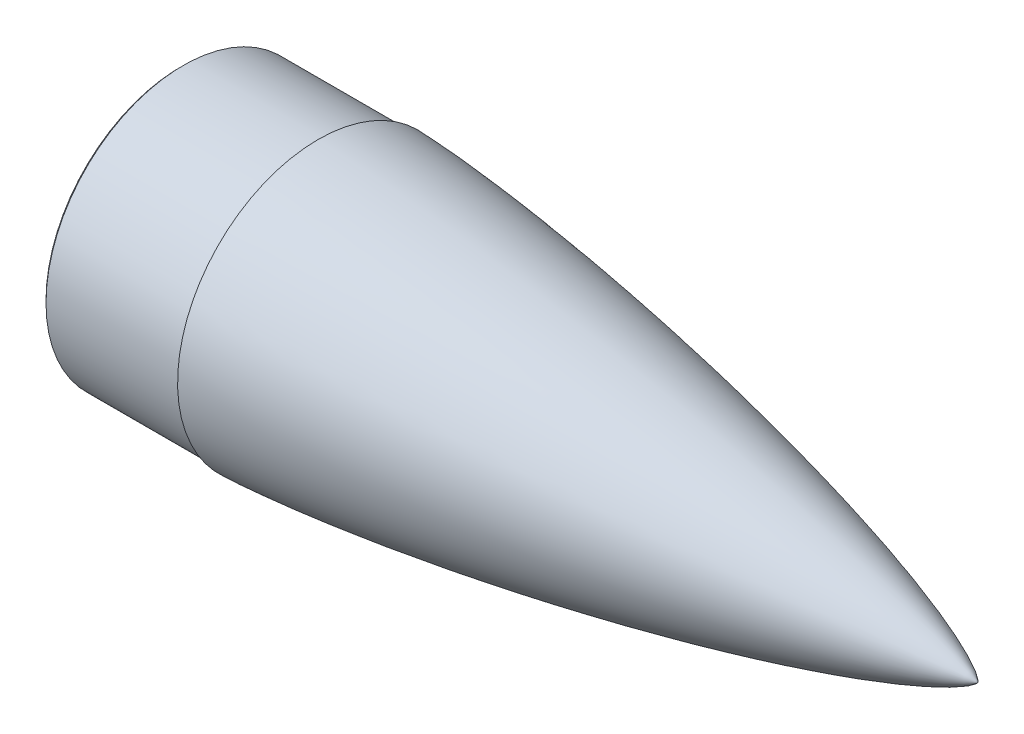
from build123d import *

# Parameters (mm, degrees)
CHAMFER1_SIZE            = 1.5
BOSS_EXTRUDE6_DEPTH      = 7.5
BOSS_EXTRUDE6_DEPTH_BACK = 7.5
SKETCH11_R               = 5


with BuildPart() as part:
    # Sketch10 → Revolve1 (revolve)
    with BuildSketch(Plane.XY):
        with BuildLine():
            Line((11.112493743, 81.99983), (11.112493743, 67.49983))
            Line((11.112493743, 67.49983), (129.304508698, 67.49983))
            add(Edge.make_bspline(
                [(368.967251823, 0), (368.965299543, 0.012338489), (368.959416882, 0.036518378), (368.940636147, 0.082964007), (368.902304552, 0.158736421), (368.845538097, 0.250270687), (368.755690124, 0.376555746), (368.616653262, 0.54835284), (368.392888737, 0.793577299), (368.008659121, 1.164904965), (367.344738263, 1.729853685), (366.176060796, 2.601559154), (364.09282389, 3.960032328), (360.425978756, 6.040734396), (354.402196649, 9.01831007), (344.042994901, 13.507695011), (329.152005398, 19.128483965), (310.425167902, 25.398569259), (288.741266406, 31.933693508), (266.378532845, 38.106125474), (243.901379123, 43.846895186), (221.331994001, 49.212017941), (198.683967629, 54.234500927), (175.966897581, 58.934255644), (156.034567874, 62.771715365), (141.509051931, 65.395628269), (132.679425236, 66.924517444), (129.562757302, 67.455859883), (129.304508698, 67.49983)],
                knots=[0, 0, 0, 0, 0, 0.000134949, 0.000269899, 0.000539798, 0.000919537, 0.001299277, 0.001947431, 0.00293136, 0.004511869, 0.007081312, 0.011380263, 0.018707867, 0.031423867, 0.052705479, 0.084103008, 0.140910136, 0.203703492, 0.266497064, 0.329290816, 0.392084375, 0.454877964, 0.517671564, 0.580465191, 0.643258828, 0.674655593, 0.677492072, 0.677492072, 0.677492072, 0.677492072, 0.677492072], degree=4))
            Line((368.967251823, 0), (408.967251823, 0))
            add(Edge.make_bspline(
                [(408.967251823, 0), (408.964913524, 0.013501739), (408.958040758, 0.039916077), (408.936520441, 0.090485698), (408.892222076, 0.174057132), (408.826281575, 0.275556803), (408.721696416, 0.415833756), (408.561101809, 0.605075245), (408.30561918, 0.87242415), (407.86966713, 1.275299562), (407.120955138, 1.885142115), (405.803773451, 2.82590185), (403.46240692, 4.287152794), (399.325294488, 6.531818454), (392.481146888, 9.758904649), (380.662076725, 14.628008466), (363.637187185, 20.711720382), (342.215241093, 27.476512989), (317.428462321, 34.49762647), (291.879335737, 41.10482439), (266.21046092, 47.228993169), (240.44548836, 52.933436777), (214.598861982, 58.255439009), (188.68089566, 63.217582693), (165.946174917, 67.253280679), (146.421982586, 70.493799722), (130.127893898, 73.044947468), (117.078590637, 74.994157933), (104.015464216, 76.84854079), (92.573263959, 78.384492045), (82.757139441, 79.635603973), (74.571340184, 80.632219902), (68.019260454, 81.400804211), (61.463723364, 82.139375899), (54.90469802, 82.84637726), (48.342159918, 83.519940506), (41.776057559, 84.15778717), (36.02754108, 84.682157239), (31.097921259, 85.105234912), (26.988317923, 85.438669825), (23.699666618, 85.693218594), (20.085807822, 85.958448038), (16.719873821, 86.189018485), (13.602098287, 86.386966779), (10.732704013, 86.554575744), (8.436635008, 86.678703291), (6.139997341, 86.792157585), (4.129892063, 86.879313264), (2.40653858, 86.944618982), (1.257348635, 86.979022496), (0.68269791, 86.99491462), (0.395312527, 86.99983)],
                knots=[0, 0, 0, 0, 0, 0.000130123, 0.000260245, 0.000520491, 0.000900391, 0.00128029, 0.001925099, 0.002881508, 0.004418208, 0.006927086, 0.011110697, 0.018279138, 0.03067276, 0.051704469, 0.08310228, 0.139908797, 0.202702513, 0.265496165, 0.328289682, 0.391083359, 0.453876973, 0.516670577, 0.579464197, 0.642257765, 0.673654596, 0.705051427, 0.736448267, 0.767845106, 0.799241874, 0.814940257, 0.830638641, 0.846337073, 0.862035505, 0.877733936, 0.893432368, 0.90913072, 0.924829072, 0.932678248, 0.940527424, 0.9483766, 0.956225776, 0.967169332, 0.97264111, 0.978112888, 0.983584666, 0.989056444, 0.994528222, 0.997264111, 1, 1, 1, 1, 1], degree=4))
            Line((0.395312527, 86.99983), (0.395312527, 84.99983))
            Line((0.395312527, 84.99983), (-84.604517473, 84.99983))
            Line((-84.604517473, 84.99983), (-84.604517473, 81.99983))
            Line((-84.604517473, 81.99983), (11.112493743, 81.99983))
        make_face()
    revolve(axis=Axis((46.917858469, 0, 0), (-1, 0, 0)))

    # Chamfer1
    chamfer1_edges = [part.edges().sort_by_distance(p)[0] for p in [
        (-84.604517473, -84.99983, 0),
    ]]
    chamfer(chamfer1_edges, length=CHAMFER1_SIZE)

    # Sketch11 → Boss-Extrude6 (add, two sides: drawn at the far end of the back side and taken through both)
    # profile 1 of 4: a face of its own
    with BuildSketch(Plane(origin=(70, 0, 0), x_dir=(0, 0, -1), z_dir=(1, 0, 0)).offset(-BOSS_EXTRUDE6_DEPTH_BACK)):
        with BuildLine():
            Line((39.645757239, 13.018375058), (39.645757239, -13.018375058))
            Line((39.645757239, -13.018375058), (66.232710279, -13.018375058))
            ThreePointArc((66.232710279, -13.018375058), (67.5, 0), (66.232710279, 13.018375058))
            Line((66.232710279, 13.018375058), (39.645757239, 13.018375058))
        make_face()
        with Locations((52.145757239, 0)):
            Circle(SKETCH11_R, mode=Mode.SUBTRACT)
    # profile 2 of 4: a face of its own
    with BuildSketch(Plane(origin=(70, 0, 0), x_dir=(0, 0, -1), z_dir=(1, 0, 0)).offset(-BOSS_EXTRUDE6_DEPTH_BACK)):
        with BuildLine():
            ThreePointArc((-13.018375058, -66.232710279), (0, -67.5), (13.018375058, -66.232710279))
            Line((13.018375058, -66.232710279), (13.018375058, -39.645757239))
            Line((13.018375058, -39.645757239), (-13.018375058, -39.645757239))
            Line((-13.018375058, -39.645757239), (-13.018375058, -66.232710279))
        make_face()
        with Locations((0, -52.145757239)):
            Circle(SKETCH11_R, mode=Mode.SUBTRACT)
    # profile 3 of 4: a face of its own
    with BuildSketch(Plane(origin=(70, 0, 0), x_dir=(0, 0, -1), z_dir=(1, 0, 0)).offset(-BOSS_EXTRUDE6_DEPTH_BACK)):
        with BuildLine():
            Line((13.018375058, 39.645757239), (13.018375058, 66.232710279))
            ThreePointArc((13.018375058, 66.232710279), (0, 67.5), (-13.018375058, 66.232710279))
            Line((-13.018375058, 66.232710279), (-13.018375058, 39.645757239))
            Line((-13.018375058, 39.645757239), (13.018375058, 39.645757239))
        make_face()
        with Locations((0, 52.145757239)):
            Circle(SKETCH11_R, mode=Mode.SUBTRACT)
    # profile 4 of 4: a face of its own
    with BuildSketch(Plane(origin=(70, 0, 0), x_dir=(0, 0, -1), z_dir=(1, 0, 0)).offset(-BOSS_EXTRUDE6_DEPTH_BACK)):
        with BuildLine():
            ThreePointArc((-66.232710279, 13.018375058), (-67.5, 0), (-66.232710279, -13.018375058))
            Line((-66.232710279, -13.018375058), (-39.645757239, -13.018375058))
            Line((-39.645757239, -13.018375058), (-39.645757239, 13.018375058))
            Line((-39.645757239, 13.018375058), (-66.232710279, 13.018375058))
        make_face()
        with Locations((-52.145757239, 0)):
            Circle(SKETCH11_R, mode=Mode.SUBTRACT)
    extrude(amount=BOSS_EXTRUDE6_DEPTH + BOSS_EXTRUDE6_DEPTH_BACK)


solid = part.part
